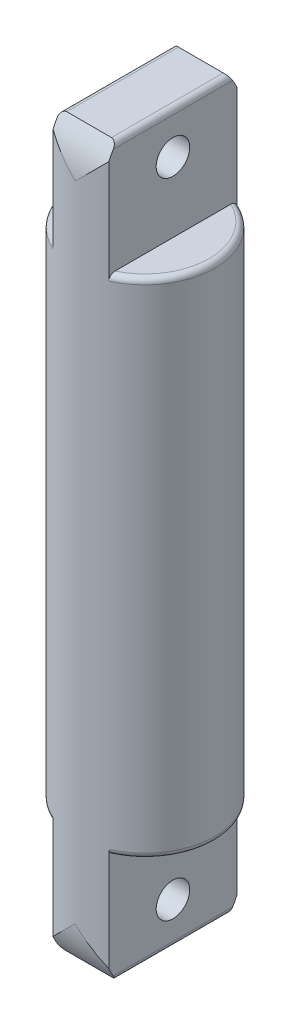
from build123d import *

# Parameters (mm, degrees)
SKETCH1_R            = 124.99999999999999
BOSS_EXTRUDE1_DEPTH  = 650
CUT_EXTRUDE1_START   = -200
CUT_EXTRUDE1_DEPTH   = 200
SKETCH4_R            = 30.000000000000007
CUT_EXTRUDE4_DEPTH   = 685.6531968814577
FILLET2_R            = 10
FILLET2_OF_MIRROR4_R = 10
FILLET3_R            = 10
FILLET4_R            = 10


with BuildPart() as part:
    # Sketch1 → Boss-Extrude1 (new body)
    with BuildSketch(Plane(origin=(0, 0, 0), x_dir=(1, 0, 0), z_dir=(0, 1, 0))):
        Circle(SKETCH1_R)
    boss_extrude1 = extrude(amount=BOSS_EXTRUDE1_DEPTH)

    # Sketch2 → Cut-Extrude1 (cut)
    with BuildSketch(Plane(origin=(0, 650, 0), x_dir=(1, 0, 0), z_dir=(0, 1, 0)).offset(CUT_EXTRUDE1_START)):
        with BuildLine():
            Line((-50, -114.56439237389277), (-50, 114.56439237389277))
            ThreePointArc((-50.00000000000426, 114.56439237389412), (-124.99999999999999, 1.531e-14), (-50.00000000000437, -114.56439237389408))
        make_face()
        with BuildLine():
            ThreePointArc((49.99999999999955, -114.56439237389618), (124.99999999999999, 7.11e-15), (49.99999999999953, 114.5643923738962))
            Line((50, 114.56439237389633), (50, -114.56439237389633))
        make_face()
    cut_extrude1 = extrude(amount=CUT_EXTRUDE1_DEPTH, mode=Mode.SUBTRACT)

    # Sketch4 → Cut-Extrude4 (cut, through all)
    with BuildSketch(Plane(origin=(50, 0, 0), x_dir=(0, 0, -1), z_dir=(1, 0, 0))):
        with BuildLine():
            Line((124.99999999999999, 575.0000000000001), (124.99999999999999, 650))
            Line((124.99999999999999, 650), (99.99999999999793, 650.0000000000014))
            ThreePointArc((99.99999999999865, 650.0000000000019), (118.58541225631386, 614.5284707521059), (125, 575.0000000000001))
        make_face()
        with BuildLine():
            Line((-99.99999999999793, 650.0000000000014), (-124.99999999999999, 650))
            Line((-124.99999999999999, 650), (-124.99999999999999, 575.0000000000001))
            ThreePointArc((-124.99999999999999, 575.0000000000001), (-118.58541225631386, 614.5284707521059), (-99.99999999999864, 650.0000000000019))
        make_face()
        with Locations((0, 575.0000000000001)):
            Circle(SKETCH4_R)
    cut_extrude4 = extrude(amount=-CUT_EXTRUDE4_DEPTH, mode=Mode.SUBTRACT)

    # Fillet2
    fillet2_edges = [part.edges().sort_by_distance(p)[0] for p in [
        (50, 650, -1.421e-14),
        (-50, 650, 0),
    ]]
    fillet(fillet2_edges, radius=FILLET2_R)

    # Mirror4: Boss-Extrude1, Cut-Extrude1, Cut-Extrude4 across plane
    add(boss_extrude1.mirror(Plane(origin=(0, 0, 0), x_dir=(0, 0, 1), z_dir=(0, -1, 0))))
    add(cut_extrude1.mirror(Plane(origin=(0, 0, 0), x_dir=(0, 0, 1), z_dir=(0, -1, 0))), mode=Mode.SUBTRACT)
    add(cut_extrude4.mirror(Plane(origin=(0, 0, 0), x_dir=(0, 0, 1), z_dir=(0, -1, 0))), mode=Mode.SUBTRACT)

    # Fillet2 of Mirror4
    fillet2_of_mirror4_edges = [part.edges().sort_by_distance(p)[0] for p in [
        (50, -650, -1.421e-14),
        (-50, -650, 0),
    ]]
    fillet(fillet2_of_mirror4_edges, radius=FILLET2_OF_MIRROR4_R)

    # Fillet3
    fillet3_edges = [part.edges().sort_by_distance(p)[0] for p in [
        (104.58250331675968, 450, -68.46531968814539),
        (-124.99999999999999, 450, -6.04e-14),
    ]]
    fillet(fillet3_edges, radius=FILLET3_R)

    # Fillet4
    fillet4_edges = [part.edges().sort_by_distance(p)[0] for p in [
        (-124.99999999999999, -450, -6.04e-14),
        (104.58250331675968, -450, -68.46531968814539),
    ]]
    fillet(fillet4_edges, radius=FILLET4_R)


solid = part.part
